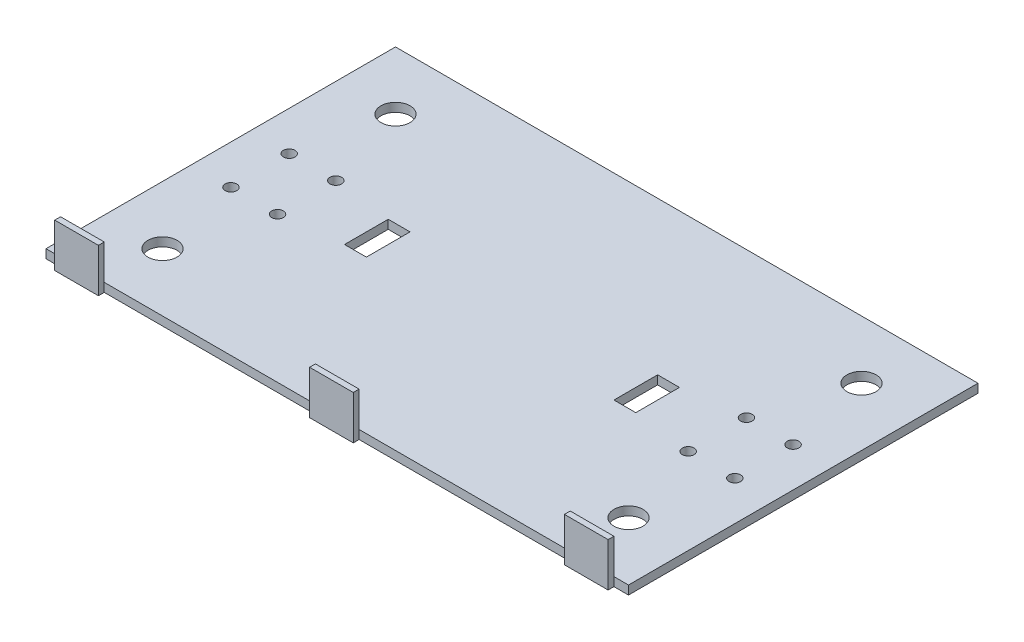
from build123d import *

# Parameters (mm, degrees)
SKETCH1_W           = 200
SKETCH1_H           = 120
BOSS_EXTRUDE3_DEPTH = 1
SKETCH3_W           = 200
SKETCH3_H           = 120
SKETCH3_R           = 5
BOSS_EXTRUDE4_DEPTH = 2
SKETCH10_W          = 15
SKETCH10_H          = 15
BOSS_EXTRUDE6_DEPTH = 2
SKETCH12_R          = 2
SKETCH12_W          = 7.5
SKETCH12_H          = 15
CUT_EXTRUDE1_DEPTH  = 119.612815496
CUT_EXTRUDE2_START  = -10
SKETCH8_R           = 5
CUT_EXTRUDE2_DEPTH  = 10


with BuildPart() as part:
    # Sketch1 → Boss-Extrude3 (new body)
    with BuildSketch(Plane(origin=(0, 0, 0), x_dir=(1, 0, 0), z_dir=(0, 1, 0))):
        Rectangle(SKETCH1_W, SKETCH1_H)
    extrude(amount=BOSS_EXTRUDE3_DEPTH)

    # Sketch3 → Boss-Extrude4 (add)
    with BuildSketch(Plane(origin=(0, 1, 0), x_dir=(1, 0, 0), z_dir=(0, 1, 0))):
        Rectangle(SKETCH3_W, SKETCH3_H)
        with Locations((-80, -40)):
            Circle(SKETCH3_R, mode=Mode.SUBTRACT)
        with Locations((80, -40)):
            Circle(SKETCH3_R, mode=Mode.SUBTRACT)
        with Locations((-80, 40)):
            Circle(SKETCH3_R, mode=Mode.SUBTRACT)
        with Locations((80, 40)):
            Circle(SKETCH3_R, mode=Mode.SUBTRACT)
    extrude(amount=BOSS_EXTRUDE4_DEPTH)

    # Sketch10 → Boss-Extrude6 (add)
    with BuildSketch(Plane.XY.offset(60)):
        with Locations((-87.5, 7.5)):
            Rectangle(SKETCH10_W, SKETCH10_H)
        with Locations((87.5, 7.5)):
            Rectangle(SKETCH10_W, SKETCH10_H)
        with Locations((0, 7.5)):
            Rectangle(SKETCH10_W, SKETCH10_H)
    extrude(amount=BOSS_EXTRUDE6_DEPTH)

    # Sketch12 → Cut-Extrude1 (cut, through all)
    with BuildSketch(Plane.XZ):
        with Locations((-86.5, 10)):
            Circle(SKETCH12_R)
        with Locations((-70.5, 10)):
            Circle(SKETCH12_R)
        with Locations((-70.5, -10)):
            Circle(SKETCH12_R)
        with Locations((-86.5, -10)):
            Circle(SKETCH12_R)
        with Locations((86.5, -10)):
            Circle(SKETCH12_R)
        with Locations((70.5, -10)):
            Circle(SKETCH12_R)
        with Locations((70.5, 10)):
            Circle(SKETCH12_R)
        with Locations((86.5, 10)):
            Circle(SKETCH12_R)
        with Locations((46.25, 0)):
            Rectangle(SKETCH12_W, SKETCH12_H)
        with Locations((-46.25, 0)):
            Rectangle(SKETCH12_W, SKETCH12_H)
    extrude(amount=-CUT_EXTRUDE1_DEPTH, mode=Mode.SUBTRACT)

    # Sketch8 → Cut-Extrude2 (cut)
    with BuildSketch(Plane(origin=(0, 3, 0), x_dir=(1, 0, 0), z_dir=(0, 1, 0)).offset(CUT_EXTRUDE2_START)):
        with Locations((-80, 40)):
            Circle(SKETCH8_R)
        with Locations((80, 40)):
            Circle(SKETCH8_R)
        with Locations((80, -40)):
            Circle(SKETCH8_R)
        with Locations((-80, -40)):
            Circle(SKETCH8_R)
    extrude(amount=CUT_EXTRUDE2_DEPTH, mode=Mode.SUBTRACT)


solid = part.part
